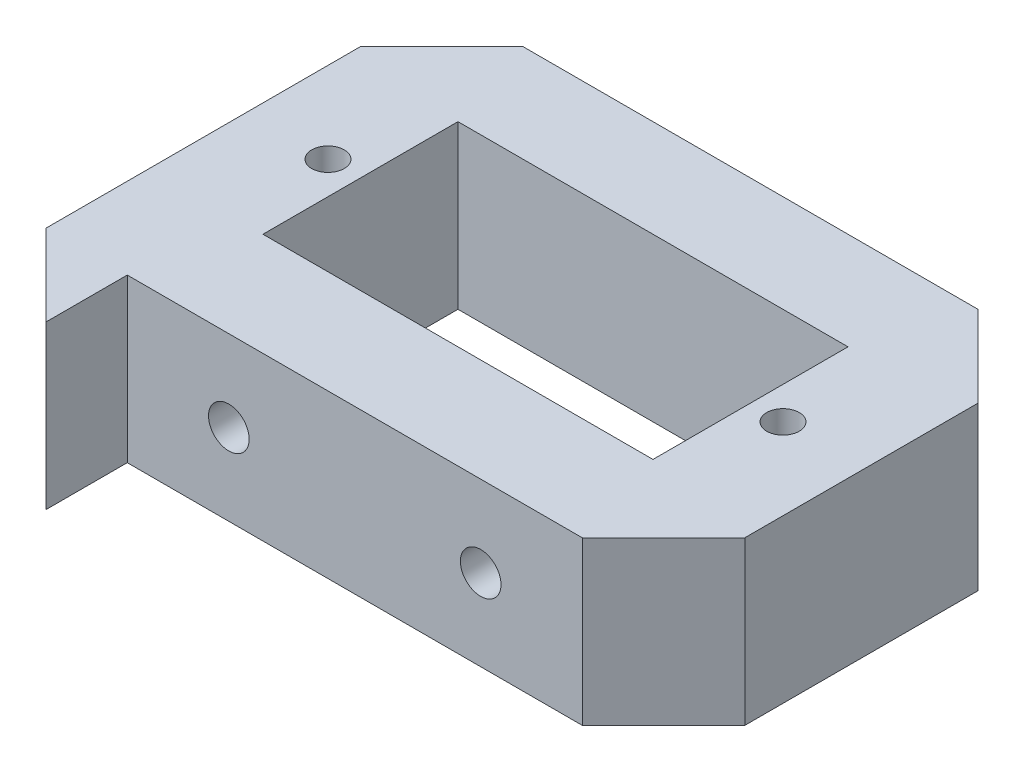
from build123d import *

# Parameters (mm, degrees)
SKETCH1_R           = 1
SKETCH1_W           = 24
SKETCH1_H           = 12
BOSS_EXTRUDE2_DEPTH = 10
CHAMFER1_SIZE       = 5
SKETCH3_R           = 1.25
CUT_EXTRUDE1_DEPTH  = 12
BOSS_EXTRUDE3_DEPTH = 10
CHAMFER2_SIZE       = 5


with BuildPart() as part:
    # Sketch1 → Boss-Extrude2 (new body)
    with BuildSketch(Plane(origin=(0, 0, 0), x_dir=(1, 0, 0), z_dir=(0, 1, 0))):
        Polygon((-18.962264151, -7.55754717), (19.037735849, -7.55754717), (19.037735849, 4.79245283), (19.037735849, 16.79245283), (-18.962264151, 16.79245283), (-18.962264151, 4.79245283), align=None)
        with Locations(Location((-13.962264151, 4.79245283, 0), (0, 0, 270))):
            Circle(SKETCH1_R, mode=Mode.SUBTRACT)
        with Locations(Location((14.037735849, 4.79245283, 0), (0, 0, 270))):
            Circle(SKETCH1_R, mode=Mode.SUBTRACT)
        with Locations((0.037735849, 4.79245283)):
            Rectangle(SKETCH1_W, SKETCH1_H, mode=Mode.SUBTRACT)
    extrude(amount=BOSS_EXTRUDE2_DEPTH)

    # Chamfer1
    chamfer1_edges = [part.edges().sort_by_distance(p)[0] for p in [
        (19.037735849, 5, 7.55754717),
        (-18.962264151, 5, 7.55754717),
        (-18.962264151, 5, -16.79245283),
        (19.037735849, 5, -16.79245283),
    ]]
    chamfer(chamfer1_edges, length=CHAMFER1_SIZE)

    # Sketch3 → Cut-Extrude1 (cut)
    with BuildSketch(Plane.XY.offset(7.55754717)):
        with Locations((-7.712264151, 5)):
            Circle(SKETCH3_R)
        with Locations((7.787735849, 5)):
            Circle(SKETCH3_R)
    extrude(amount=-CUT_EXTRUDE1_DEPTH, mode=Mode.SUBTRACT)

    # Sketch4 → Boss-Extrude3 (add)
    with BuildSketch(Plane(origin=(0, 10, 0), x_dir=(1, 0, 0), z_dir=(0, 1, 0))):
        Polygon((-13.962264151, -7.55754717), (-13.962264151, -12.55754717), (-18.962264151, -12.55754717), (-18.962264151, -2.55754717), (-13.962264151, -0.983393269), align=None)
    extrude(amount=-BOSS_EXTRUDE3_DEPTH)

    # Chamfer2
    chamfer2_edges = [part.edges().sort_by_distance(p)[0] for p in [
        (-18.962264151, 5, 12.55754717),
    ]]
    chamfer(chamfer2_edges, length=CHAMFER2_SIZE - 0.0001)  # a hair under: the kernel refuses the full size


solid = part.part
